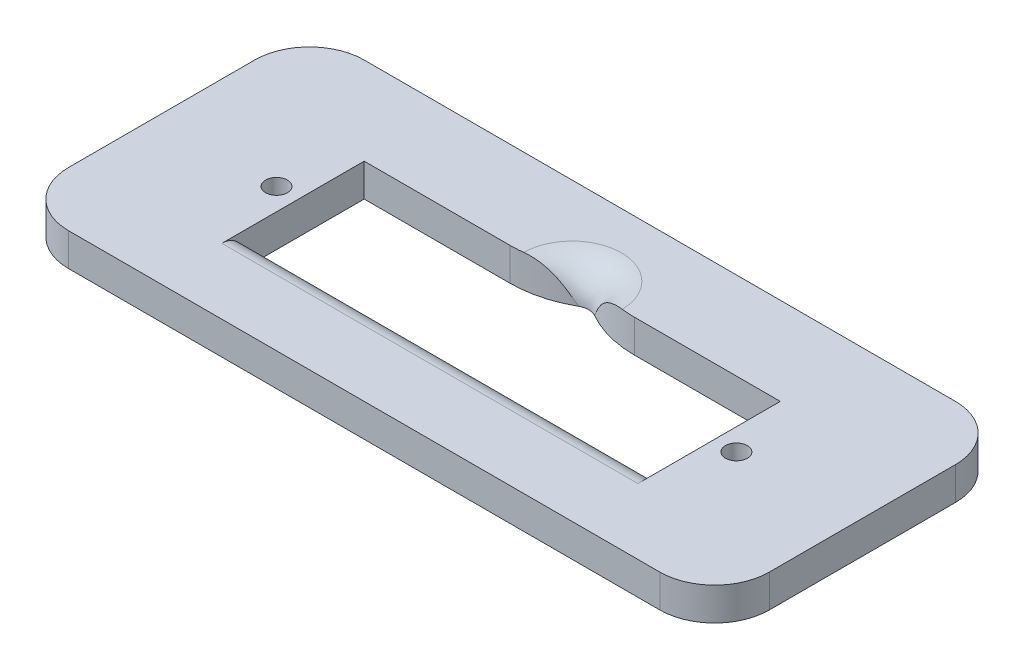
from build123d import *

# Parameters (mm, degrees)
SKETCH1_R           = 1
SKETCH1_W           = 38
SKETCH1_H           = 11
MAIN_EXTRUDE_DEPTH  = 3
WIRE_CUT_DEPTH      = 35.860436027
WIRE_CUT_DEPTH_BACK = 35.860436027
SKETCH2_R           = 1.5
FILLET1_R           = 10
FILLET2_R           = 3
FILLET3_R           = 2


with BuildPart() as part:
    # Sketch1 → Main extrude (new body)
    with BuildSketch(Plane(origin=(0, 0, 0), x_dir=(1, 0, 0), z_dir=(0, 1, 0))):
        with BuildLine():
            Line((-32, 8.5), (-32, -8.5))
            ThreePointArc((-32, -8.5), (-30.535533906, -12.035533906), (-27, -13.5))
            Line((-27, -13.5), (27, -13.5))
            ThreePointArc((27, -13.5), (30.535533906, -12.035533906), (32, -8.5))
            Line((32, -8.5), (32, 8.5))
            ThreePointArc((32, 8.5), (30.535533906, 12.035533906), (27, 13.5))
            Line((27, 13.5), (-27, 13.5))
            ThreePointArc((-27, 13.5), (-30.535533906, 12.035533906), (-32, 8.5))
        make_face()
        with Locations(Location((-21.005953225, -0.5, 0), (0, 0, 270))):
            Circle(SKETCH1_R, mode=Mode.SUBTRACT)
        with Locations(Location((20.994046775, -0.5, 0), (0, 0, 270))):
            Circle(SKETCH1_R, mode=Mode.SUBTRACT)
        Rectangle(SKETCH1_W, SKETCH1_H, mode=Mode.SUBTRACT)
    extrude(amount=MAIN_EXTRUDE_DEPTH)

    # Sketch2 → Wire cut (cut, two sides: drawn at the far end of the back side and taken through both)
    with BuildSketch(Plane(origin=(0, 3, 0), x_dir=(1, 0, 0), z_dir=(0, 1, 0)).offset(-WIRE_CUT_DEPTH_BACK)):
        with Locations((0, 5.5)):
            Circle(SKETCH2_R)
    extrude(amount=WIRE_CUT_DEPTH + WIRE_CUT_DEPTH_BACK, mode=Mode.SUBTRACT)

    # Fillet1
    fillet1_edges = [part.edges().sort_by_distance(p)[0] for p in [
        (-1.5, 1.5, -5.5),
        (1.5, 1.5, -5.5),
    ]]
    fillet(fillet1_edges, radius=FILLET1_R)

    # Fillet2
    # the kernel refuses this fillet: 3 mm, written as the material it takes off along each edge
    with BuildSketch(Plane(origin=(0, 3, -5.5), x_dir=(0.003141587485879651, 0, 0.9999950652018582), z_dir=(-0.9999950652018582, 0, 0.003141587485879651))) as fillet2_piece_1:
        with BuildLine():
            CenterArc((1.5 + FILLET2_R, -FILLET2_R), FILLET2_R, 90, 90)
            Line((1.5 + FILLET2_R, 0), (1.5, 0))
            Line((1.5, 0), (1.5, -FILLET2_R))
        make_face()
    revolve(axis=Axis((0, 3, -5.5), (0, 1, 0)), revolution_arc=359.64, mode=Mode.SUBTRACT)

    # Fillet3
    fillet3_edges = [part.edges().sort_by_distance(p)[0] for p in [
        (0, 3, 5.5),
    ]]
    fillet(fillet3_edges, radius=FILLET3_R)


solid = part.part
